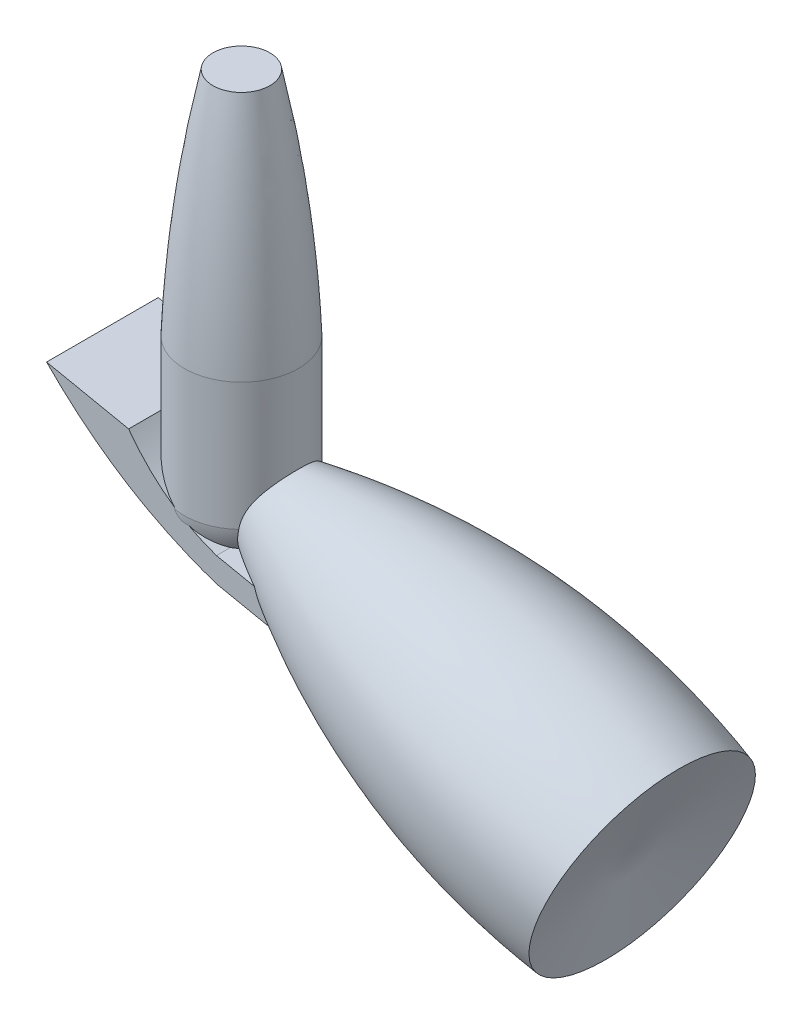
from build123d import *

# Parameters (mm, degrees)
SALIENTE_EXTRUIR2_DEPTH      = 6
SALIENTE_EXTRUIR2_DEPTH_BACK = 6
CORTAR_EXTRUIR4_DEPTH        = 12


with BuildPart() as part:
    # Croquis1 → Revolución1 (revolve)
    with BuildSketch(Plane.XY):
        with BuildLine():
            Line((-7.033234146, -46.672188296), (-7.033234146, -55.075487512))
            Line((-7.033234146, -55.075487512), (-10.092778878, -55.075487512))
            add(Edge.make_bspline(
                [(-10.092778878, -55.075487512), (-12.839641643, -53.415353035), (-13.152323611, -50.178957058)],
                knots=[0, 0, 0, 1, 1, 1], degree=2))
            Line((-13.152323611, -50.178957058), (-13.152323611, -36.477858501))
            add(Edge.make_bspline(
                [(-10.092778878, -11.672188296), (-12.679342396, -23.944057614), (-13.152323611, -36.477858501)],
                knots=[0, 0, 0, 1, 1, 1], degree=2))
            Line((-10.092778878, -11.672188296), (-7.033234146, -11.672188296))
            Line((-7.033234146, -11.672188296), (-7.033234146, -46.672188296))
        make_face()
    revolve(axis=Axis((-7.033234146, -11.672188296, 0), (0, -1, 0)))

    # Croquis4 → Revolución3 (revolve)
    with BuildSketch(Plane.XY, mode=Mode.PRIVATE) as revoluci_n3_sk:
        with BuildLine():
            Line((-2.543823692, -50.178957058), (34.743219879, -63.67321347))
            Line((34.743219879, -63.67321347), (32.112971501, -74.975712644))
            add(Edge.make_bspline(
                [(-4.974381083, -53.62956537), (10.48469865, -69.661897457), (32.112971501, -74.975712644)],
                knots=[0, 0, 0, 1, 1, 1], degree=2))
            Line((-4.974381083, -53.62956537), (-3.973689414, -49.661485764))
            Line((-3.973689414, -49.661485764), (-2.543823692, -50.178957058))
        make_face()
    revolve(revoluci_n3_sk.sketch.rotate(Axis((-2.543823692, -50.178957058, 0), (0.9403160901238965, -0.34030229304856024, 0)), 180), axis=Axis((-2.543823692, -50.178957058, 0), (0.9403160901238965, -0.34030229304856024, 0)))


with BuildPart() as saliente_extruir2_tool:
    # Croquis5 → Saliente-Extruir2 (new, two sides: drawn at the far end of the back side and taken through both)
    with BuildSketch(Plane.XY.offset(-SALIENTE_EXTRUIR2_DEPTH_BACK)):
        with BuildLine():
            Line((-21.973079178, -43.393121432), (-13.152323611, -45.207630446))
            add(Edge.make_bspline(
                [(-13.152323611, -45.207630446), (-9.497910273, -50.263383164), (-3.71235192, -52.280489046)],
                knots=[0, 0, 0, 1, 1, 1], degree=2))
            Line((-3.71235192, -52.280489046), (4.845267721, -54.040868626))
            Line((4.845267721, -54.040868626), (4.326248654, -56.56394252))
            Line((4.326248654, -56.56394252), (-3.71235192, -54.910329846))
            add(Edge.make_bspline(
                [(-21.973079178, -43.393121432), (-14.181554461, -51.379124297), (-3.71235192, -54.910329846)],
                knots=[0, 0, 0, 1, 1, 1], degree=2))
        make_face()
    extrude(amount=SALIENTE_EXTRUIR2_DEPTH + SALIENTE_EXTRUIR2_DEPTH_BACK)


with BuildPart() as part_1:
    add(part.part)


with BuildPart() as part_2:
    # Saliente-Extruir2: joined with saliente_extruir2_tool
    add(part_1.part.fuse(saliente_extruir2_tool.part, tol=0.00001))

    # Croquis6 → Cortar-Extruir4 (cut)
    with BuildSketch(Plane.XY.offset(6)):
        with BuildLine():
            Line((-13.183418628, -50.470769028), (-12.787980237, -55.716319365))
            Line((-12.787980237, -55.716319365), (-3.71235192, -55.716319365))
            Line((-3.71235192, -55.716319365), (-3.71235192, -54.910329846))
            add(Edge.make_bspline(
                [(-3.71235192, -54.910329846), (-8.705719687, -53.233709844), (-13.183418628, -50.470769028)],
                knots=[0, 0, 0, 1, 1, 1], degree=2))
        make_face()
    extrude(amount=-CORTAR_EXTRUIR4_DEPTH, mode=Mode.SUBTRACT)


solid = part_2.part
